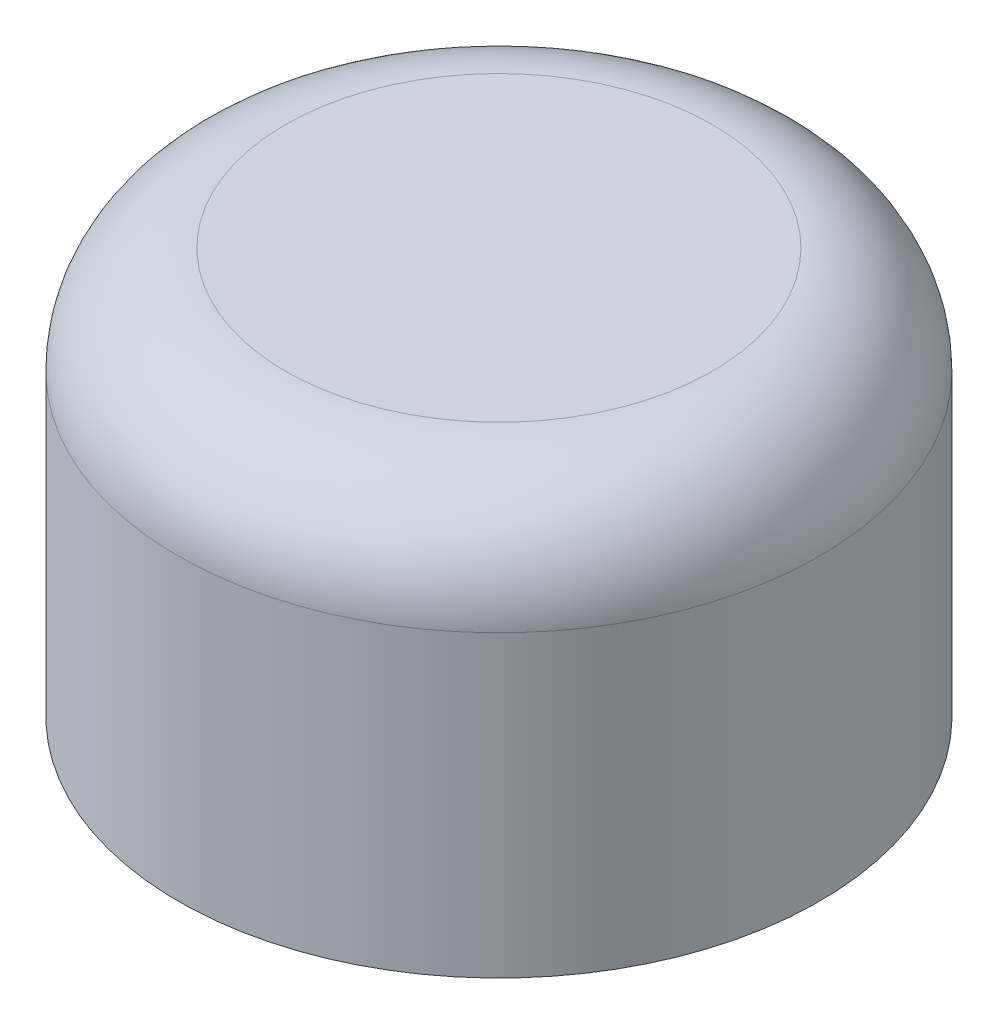
from build123d import *

# Parameters (mm, degrees)
EXTRUDE_1_DEPTH = 13


with BuildPart() as part:
    # ｽｹｯﾁ1 → 回転1 (revolve)
    with BuildSketch(Plane.XY):
        with BuildLine():
            Line((0, 20), (10, 20))
            ThreePointArc((10, 20), (13.535533906, 18.535533906), (15, 15))
            Line((15, 15), (15, 1))
            Line((15, 1), (14, 1))
            Line((14, 1), (14, 3.5))
            Line((14, 3.5), (0, 3.5))
            Line((0, 3.5), (0, 6.5))
            Line((0, 6.5), (14, 6.5))
            Line((14, 6.5), (14, 15))
            ThreePointArc((14, 15), (12.828427125, 17.828427125), (10, 19))
            Line((10, 19), (0, 19))
            Line((0, 19), (0, 20))
        make_face()
    revolve(axis=Axis((0, 3.5, 0), (0, 1, 0)))

    # ｽｹｯﾁ2 → ﾎﾞｽ - 押し出し1 (add)
    with BuildSketch(Plane(origin=(0, 6.5, 0), x_dir=(1, 0, 0), z_dir=(0, 1, 0))):
        Polygon((-0.75, 0.75), (-0.75, 8), (0.75, 8), (0.75, 0.75), (8, 0.75), (8, -0.75), (0.75, -0.75), (0.75, -8), (-0.75, -8), (-0.75, -0.75), (-8, -0.75), (-8, 0.75), align=None)
    extrude(amount=EXTRUDE_1_DEPTH)


solid = part.part
